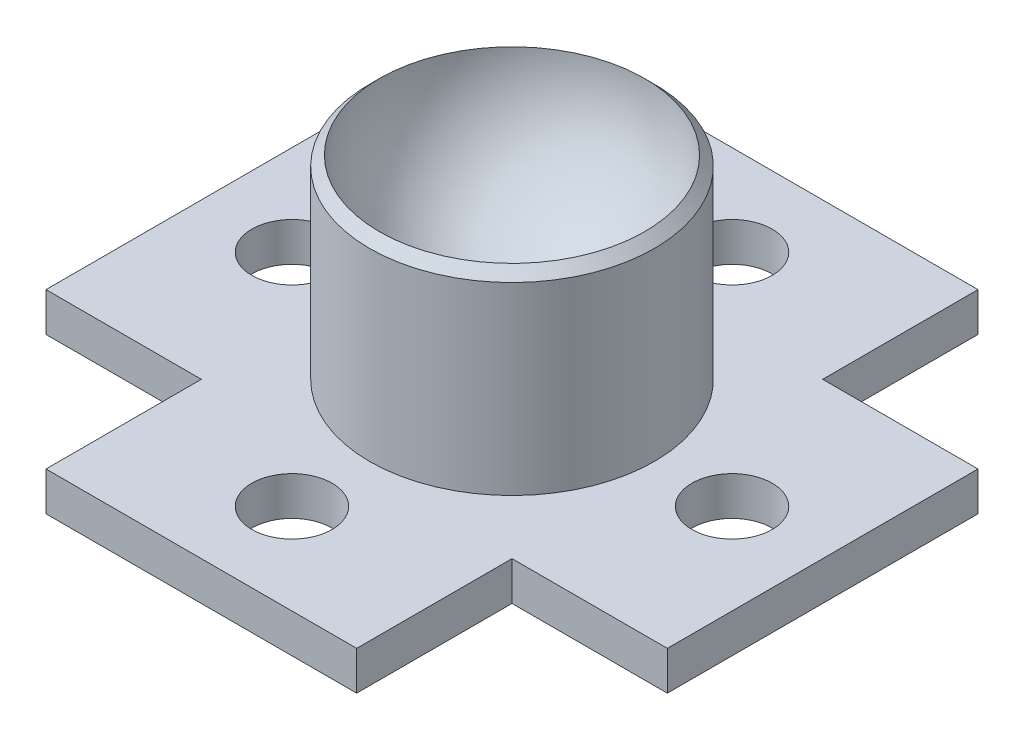
from build123d import *

# Parameters (mm, degrees)
SKETCH1_R           = 3.1
BOSS_EXTRUDE1_DEPTH = 3
BOSS_EXTRUDE2_START = 3
SKETCH1_5_R         = 11
BOSS_EXTRUDE2_DEPTH = 15
CHAMFER1_SIZE       = 0.75


with BuildPart() as part:
    # Sketch1 → Boss-Extrude1 (new body)
    with BuildSketch(Plane(origin=(0, 0, 0), x_dir=(1, 0, 0), z_dir=(0, 1, 0))):
        Polygon((24, 12), (24, -12), (12, -12), (12, -24), (-12, -24), (-12, -12), (-24, -12), (-24, 12), (-12, 12), (-12, 24), (12, 24), (12, 12), align=None)
        with Locations(Location((17, 0, 0), (0, 0, 270))):
            Circle(SKETCH1_R, mode=Mode.SUBTRACT)
        with Locations(Location((0, -17, 0), (0, 0, 270))):
            Circle(SKETCH1_R, mode=Mode.SUBTRACT)
        with Locations(Location((0, 17, 0), (0, 0, 270))):
            Circle(SKETCH1_R, mode=Mode.SUBTRACT)
        with Locations(Location((-17, 0, 0), (0, 0, 270))):
            Circle(SKETCH1_R, mode=Mode.SUBTRACT)
    extrude(amount=BOSS_EXTRUDE1_DEPTH)

    # Sketch1<5> → Boss-Extrude2 (add)
    with BuildSketch(Plane(origin=(0, 0, 0), x_dir=(1, 0, 0), z_dir=(0, 1, 0)).offset(BOSS_EXTRUDE2_START)):
        with Locations(Location((0, 0, 0), (0, 0, 270))):
            Circle(SKETCH1_5_R)
    extrude(amount=BOSS_EXTRUDE2_DEPTH)

    # Sketch3 → Cut-Revolve3 (revolve, cut)
    with BuildSketch(Plane.XY, mode=Mode.PRIVATE) as cut_revolve3_sk:
        with BuildLine():
            Line((0, 18), (10.25, 18))
            ThreePointArc((10.25, 18), (7.247844507, 10.752155493), (0, 7.75))
            Line((0, 7.75), (0, 18))
        make_face()
    revolve(cut_revolve3_sk.sketch.rotate(Axis((0, 18, 0), (0, -1, 0)), 180), axis=Axis((0, 18, 0), (0, -1, 0)), mode=Mode.SUBTRACT)

    # Chamfer1
    chamfer1_edges = [part.edges().sort_by_distance(p)[0] for p in [
        (0, 18, -11),
    ]]
    chamfer(chamfer1_edges, length=CHAMFER1_SIZE - 0.0001)  # a hair under: the kernel refuses the full size


solid = part.part
